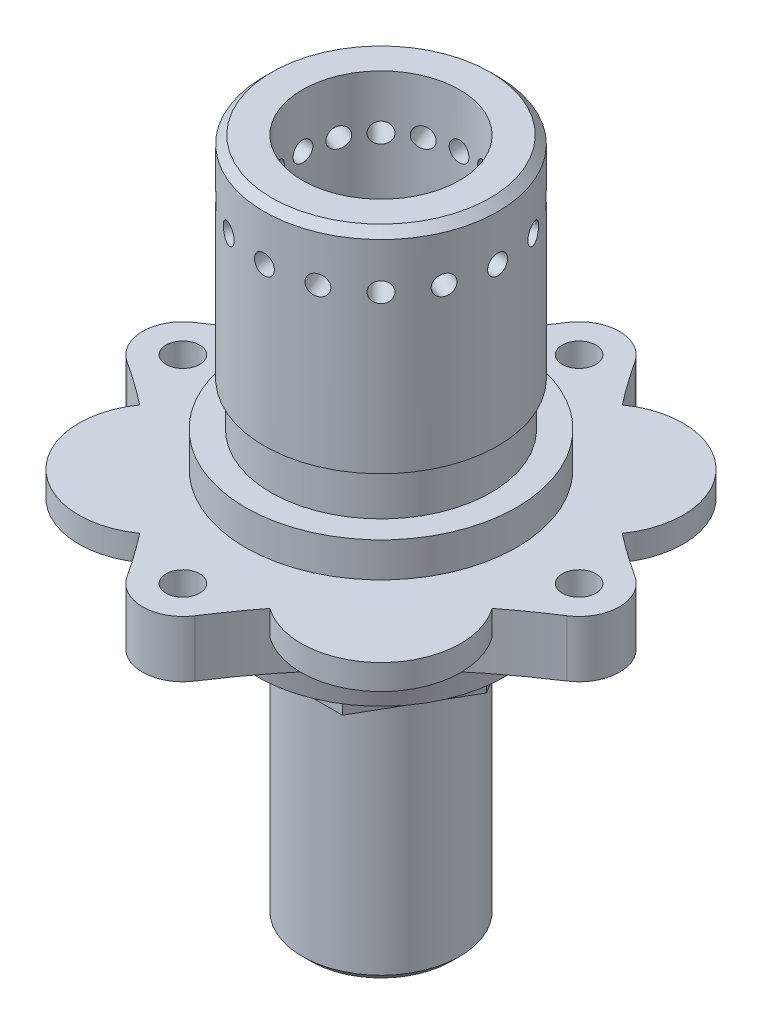
from build123d import *

# Parameters (mm, degrees)
SKETCH5_W                     = 15.875
SKETCH5_H                     = 79.375
DRIVE_PIN_HOLES_D             = 6.8
DRIVE_PIN_HOLES_PATTERN_COUNT = 4
FLANGE_START                  = -6.35
SKETCH8_R                     = 52.5
FLANGE_SUPPORT_CUT_DEPTH      = 6.35
SKETCH9_R                     = 52.5
FLORAL_PATTERN_CUT_DEPTH      = 105.693697966
SKETCH10_R                    = 25.0825
BRAKE_HAT_HEX_DEPTH           = 4.7625
M10_CLEARANCE_HOLE1_D         = 11
SKETCH14_R                    = 2
PIN_HOLES_DEPTH               = 98.561648779
PIN_HOLE_PATTERN_COUNT        = 16


with BuildPart() as part:
    # Sketch1 → Bearing Shaft/Flange Support (revolve)
    with BuildSketch(Plane(origin=(0, 0, 0), x_dir=(0, 0, -1), z_dir=(1, 0, 0))):
        Polygon((0, 0), (-27.254672075, 0), (-25.0825, -12.319), (-25.0825, -17.0815), (-15.875, -17.0815), (-15.875, -65.8749), (-14.2875, -67.4624), (0, -67.4624), align=None)
    revolve(axis=Axis((0, 0, 0), (0, 1, 0)))

    # Sketch2 → Drive Pin Support (revolve)
    with BuildSketch(Plane(origin=(0, 0, 0), x_dir=(0, 0, -1), z_dir=(1, 0, 0))):
        Polygon((0, 0), (-52.5, 0), (-52.5, 11.43), (-27.4096, 11.43), (-27.4096, 18.43), (-22.225, 18.43), (-22.225, 27.305), (-23.61946, 27.305), (-23.61946, 68.2625), (-22.03196, 69.85), (0, 69.85), align=None)
    revolve(axis=Axis((0, 0, 0), (0, 1, 0)))

    # Sketch5 → Center Mass Removal (revolve, cut)
    with BuildSketch(Plane(origin=(0, 0, 0), x_dir=(0, 0, -1), z_dir=(1, 0, 0))):
        with Locations((7.9375, 30.1625)):
            Rectangle(SKETCH5_W, SKETCH5_H)
    revolve(axis=Axis((0, 0, 0), (0, -1, 0)), mode=Mode.SUBTRACT)

    # Drive Pin Holes (through all)
    with Locations(Plane(origin=(0, 0, 0), x_dir=(-1, 0, 0), z_dir=(0, -1, 0))):
        with Locations((0, -40)):
            drive_pin_holes = Hole(DRIVE_PIN_HOLES_D / 2)

    # Drive Pin Holes Pattern: Drive Pin Holes ×4 about axis
    drive_pin_holes_pattern_axis = Axis((0, 0, 0), (0, -1, 0))
    for i in range(1, DRIVE_PIN_HOLES_PATTERN_COUNT):
        add(drive_pin_holes.rotate(drive_pin_holes_pattern_axis, i * 360 / DRIVE_PIN_HOLES_PATTERN_COUNT), mode=Mode.SUBTRACT)

    # Sketch8 → Flange Support Cut (cut)
    with BuildSketch(Plane.XZ.offset(FLANGE_START)):
        Circle(SKETCH8_R)
        with BuildLine():
            ThreePointArc((-6.851776468, 44.436165629), (0, 48.1625), (6.851776468, 44.436165629))
            ThreePointArc((6.851776468, 44.436165629), (23.655722013, 23.655722013), (44.436165629, 6.851776468))
            ThreePointArc((44.436165629, 6.851776468), (48.1625, 0), (44.436165629, -6.851776468))
            ThreePointArc((44.436165629, -6.851776468), (23.655722013, -23.655722013), (6.851776468, -44.436165629))
            ThreePointArc((6.851776468, -44.436165629), (0, -48.1625), (-6.851776468, -44.436165629))
            ThreePointArc((-6.851776468, -44.436165629), (-23.655722013, -23.655722013), (-44.436165629, -6.851776468))
            ThreePointArc((-44.436165629, -6.851776468), (-48.1625, 0), (-44.436165629, 6.851776468))
            ThreePointArc((-44.436165629, 6.851776468), (-23.655722013, 23.655722013), (-6.851776468, 44.436165629))
        make_face(mode=Mode.SUBTRACT)
    extrude(amount=FLANGE_SUPPORT_CUT_DEPTH, mode=Mode.SUBTRACT)

    # Sketch9 → Floral Pattern Cut (cut, through all)
    with BuildSketch(Plane.XZ.offset(-6.35)):
        Circle(SKETCH9_R)
        with BuildLine():
            ThreePointArc((-44.436165629, -6.851776468), (-48.1625, 0), (-44.436165629, 6.851776468))
            ThreePointArc((-44.436165629, 6.851776468), (-39.943623391, 9.89866373), (-35.585386853, 13.13474655))
            ThreePointArc((-35.585386853, 13.13474655), (-33.837199119, 33.837199119), (-13.13474655, 35.585386853))
            ThreePointArc((-13.13474655, 35.585386853), (-9.89866373, 39.943623391), (-6.851776468, 44.436165629))
            ThreePointArc((-6.851776468, 44.436165629), (0, 48.1625), (6.851776468, 44.436165629))
            ThreePointArc((6.851776468, 44.436165629), (9.89866373, 39.943623391), (13.13474655, 35.585386853))
            ThreePointArc((13.13474655, 35.585386853), (33.837199119, 33.837199119), (35.585386853, 13.13474655))
            ThreePointArc((35.585386853, 13.13474655), (39.943623391, 9.89866373), (44.436165629, 6.851776468))
            ThreePointArc((44.436165629, 6.851776468), (48.1625, 0), (44.436165629, -6.851776468))
            ThreePointArc((44.436165629, -6.851776468), (39.943623391, -9.89866373), (35.585386852, -13.13474655))
            ThreePointArc((35.585386852, -13.13474655), (33.837199119, -33.837199119), (13.13474655, -35.585386853))
            ThreePointArc((13.13474655, -35.585386853), (9.89866373, -39.943623391), (6.851776468, -44.436165629))
            ThreePointArc((6.851776468, -44.436165629), (0, -48.1625), (-6.851776468, -44.436165629))
            ThreePointArc((-6.851776468, -44.436165629), (-9.89866373, -39.943623391), (-13.13474655, -35.585386853))
            ThreePointArc((-13.13474655, -35.585386853), (-33.837199119, -33.837199119), (-35.585386853, -13.13474655))
            ThreePointArc((-35.585386853, -13.13474655), (-39.943623391, -9.89866373), (-44.436165629, -6.851776468))
        make_face(mode=Mode.SUBTRACT)
    extrude(amount=-FLORAL_PATTERN_CUT_DEPTH, mode=Mode.SUBTRACT)

    # Sketch10 → Brake Hat Hex (cut)
    with BuildSketch(Plane.XZ.offset(17.0815)):
        Circle(SKETCH10_R)
        Polygon((10.631905207, -18.415), (21.263810414, 0), (10.631905207, 18.415), (-10.631905207, 18.415), (-21.263810414, 0), (-10.631905207, -18.415), align=None, mode=Mode.SUBTRACT)
    extrude(amount=-BRAKE_HAT_HEX_DEPTH, mode=Mode.SUBTRACT)

    # M10 Clearance Hole1 (through all)
    with Locations(Plane(origin=(0, -67.4624, 0), x_dir=(-1, 0, 0), z_dir=(0, -1, 0))):
        with Locations((0, 0)):
            Hole(M10_CLEARANCE_HOLE1_D / 2)

    # Sketch14 → Pin Holes (cut, through all)
    with BuildSketch(Plane(origin=(0, 0, 0), x_dir=(0, 0, -1), z_dir=(1, 0, 0))):
        with Locations((0, 59.05)):
            Circle(SKETCH14_R)
    pin_holes = extrude(amount=-PIN_HOLES_DEPTH, mode=Mode.SUBTRACT)

    # Pin Hole Pattern: Pin Holes ×16 about axis
    pin_hole_pattern_axis = Axis((0, 0, 0), (0, -1, 0))
    for i in range(1, PIN_HOLE_PATTERN_COUNT):
        add(pin_holes.rotate(pin_hole_pattern_axis, i * 360 / PIN_HOLE_PATTERN_COUNT), mode=Mode.SUBTRACT)


solid = part.part
